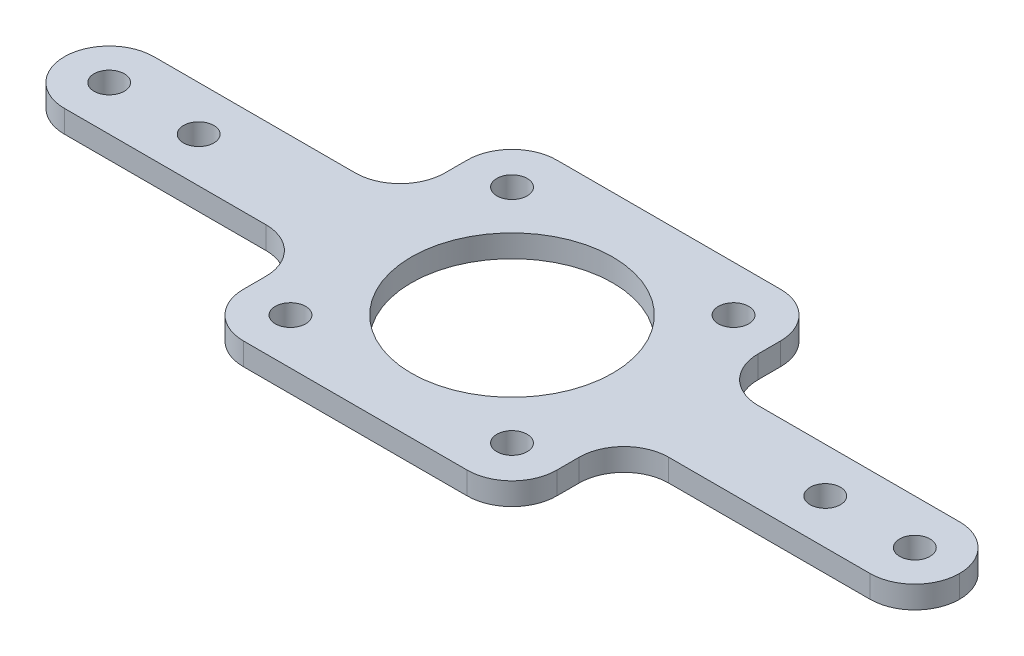
from build123d import *

# Parameters (mm, degrees)
SKETCH1_W                    = 44.45
SKETCH1_H                    = 12.7
SKETCH1_H_2                  = 15.875
SKETCH1_W_2                  = 41.275
BOSS_EXTRUDE1_DEPTH          = 3.175
SKETCH3_R                    = 14.2875
CUT_EXTRUDE1_DEPTH           = 68.351920908
F_18_0_1695_DIAMETER_HOLE1_D = 4.3053
CIRPATTERN1_COUNT            = 4
FILLET1_R                    = 6.35
FILLET2_R                    = 6.35
F_18_0_1695_DIAMETER_HOLE2_D = 4.3053


with BuildPart() as part:
    # Sketch1 → Boss-Extrude1 (new body)
    with BuildSketch(Plane(origin=(0, 0, 0), x_dir=(1, 0, 0), z_dir=(0, 1, 0))):
        Rectangle(SKETCH1_W, SKETCH1_H)
        with Locations((0, -14.2875)):
            Rectangle(SKETCH1_W, SKETCH1_H_2)
        with Locations((42.8625, 0)):
            Rectangle(SKETCH1_W_2, SKETCH1_H)
        with Locations((0, 14.2875)):
            Rectangle(SKETCH1_W, SKETCH1_H_2)
        with Locations((-42.8625, 0)):
            Rectangle(SKETCH1_W_2, SKETCH1_H)
    extrude(amount=BOSS_EXTRUDE1_DEPTH)

    # Sketch3 → Cut-Extrude1 (cut, through all)
    with BuildSketch(Plane(origin=(0, 3.175, 0), x_dir=(1, 0, 0), z_dir=(0, 1, 0))):
        with Locations(Location((0, 0, 0), (0, 0, 270))):
            Circle(SKETCH3_R)
    extrude(amount=-CUT_EXTRUDE1_DEPTH, mode=Mode.SUBTRACT)

    # #18 (0.1695) Diameter Hole1 (through all)
    with Locations(Plane(origin=(0, 3.175, 0), x_dir=(1, 0, 0), z_dir=(0, 1, 0))):
        with Locations((-15.715448212, -15.715448212)):
            f_18_0_1695_diameter_hole1 = Hole(F_18_0_1695_DIAMETER_HOLE1_D / 2)

    # CirPattern1: #18 (0.1695) Diameter Hole1 ×4 about axis
    cirpattern1_axis = Axis((0, 0, 0), (0, 1, 0))
    for i in range(1, CIRPATTERN1_COUNT):
        add(f_18_0_1695_diameter_hole1.rotate(cirpattern1_axis, i * 360 / CIRPATTERN1_COUNT), mode=Mode.SUBTRACT)

    # Fillet1
    fillet1_edges = [part.edges().sort_by_distance(p)[0] for p in [
        (-22.225, 1.5875, 6.35),
        (-22.225, 1.5875, -6.35),
        (22.225, 1.5875, -6.35),
        (22.225, 1.5875, 6.35),
    ]]
    fillet(fillet1_edges, radius=FILLET1_R)

    # Fillet2
    fillet2_edges = [part.edges().sort_by_distance(p)[0] for p in [
        (-63.5, 1.5875, 6.35),
        (-63.5, 1.5875, -6.35),
        (-22.225, 1.5875, -22.225),
        (22.225, 1.5875, -22.225),
        (63.5, 1.5875, -6.35),
        (63.5, 1.5875, 6.35),
        (22.225, 1.5875, 22.225),
        (-22.225, 1.5875, 22.225),
    ]]
    fillet(fillet2_edges, radius=FILLET2_R - 0.0001)  # a hair under: the kernel refuses the full size

    # #18 (0.1695) Diameter Hole2 (through all)
    with Locations(Plane(origin=(0, 3.175, 0), x_dir=(1, 0, 0), z_dir=(0, 1, 0))):
        with Locations((44.45, 0), (57.15, 0)):
            f_18_0_1695_diameter_hole2 = Hole(F_18_0_1695_DIAMETER_HOLE2_D / 2)

    # Mirror1: #18 (0.1695) Diameter Hole2 across plane
    add(f_18_0_1695_diameter_hole2.mirror(Plane(origin=(0, 0, 0), x_dir=(0, 0, 1), z_dir=(1, 0, 0))), mode=Mode.SUBTRACT)


solid = part.part
